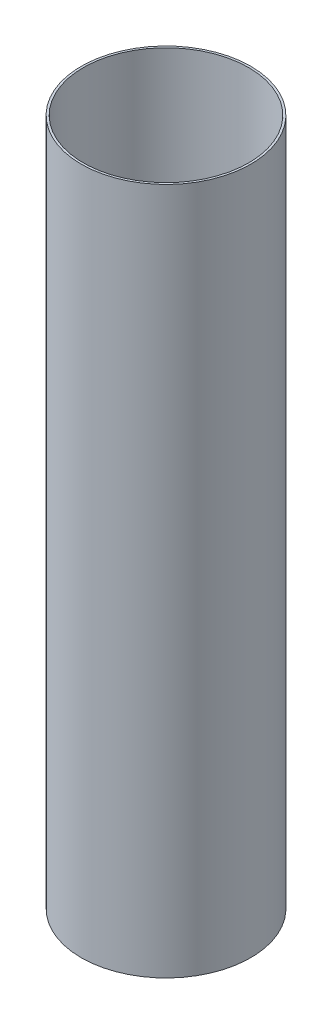
from build123d import *

# Parameters (mm, degrees)
SKETCH2_R           = 78.359
SKETCH2_R_2         = 76.3651
BOSS_EXTRUDE1_DEPTH = 635


with BuildPart() as part:
    # Sketch2 → Boss-Extrude1 (new body)
    with BuildSketch(Plane(origin=(0, 0, 0), x_dir=(1, 0, 0), z_dir=(0, 1, 0))):
        Circle(SKETCH2_R)
        Circle(SKETCH2_R_2, mode=Mode.SUBTRACT)
    extrude(amount=BOSS_EXTRUDE1_DEPTH)


solid = part.part
